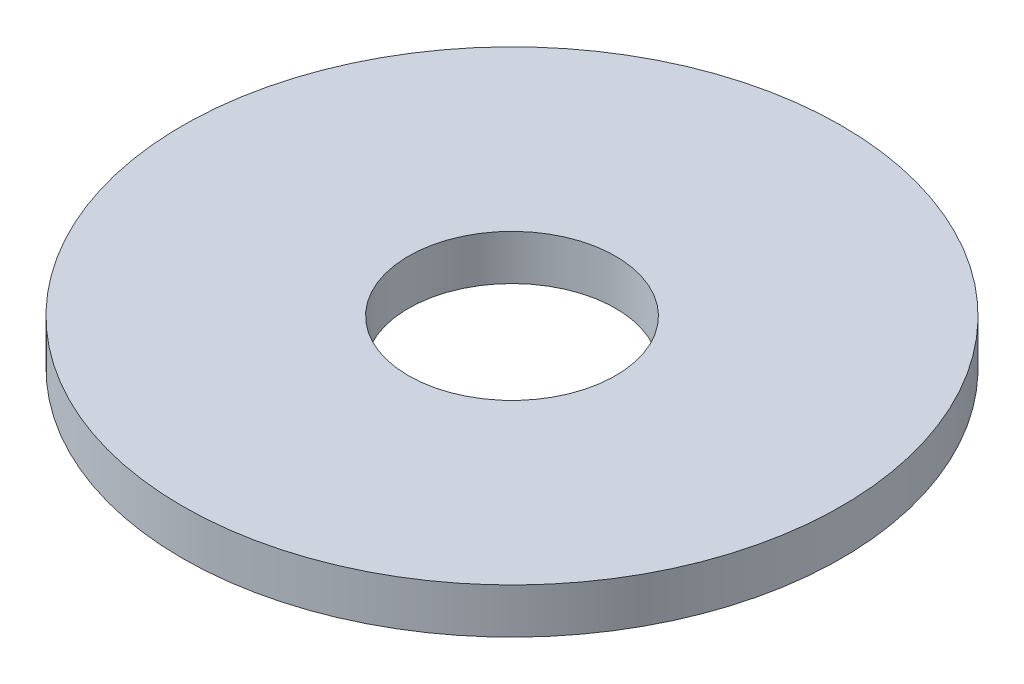
from build123d import *

# Parameters (mm, degrees)
SKETCH1_R           = 87.5
BOSS_EXTRUDE1_DEPTH = 12
SKETCH2_R           = 27.5
CUT_EXTRUDE1_DEPTH  = 125.324173032


with BuildPart() as part:
    # Sketch1 → Boss-Extrude1 (new body)
    with BuildSketch(Plane(origin=(0, 0, 0), x_dir=(1, 0, 0), z_dir=(0, 1, 0))):
        Circle(SKETCH1_R)
    extrude(amount=BOSS_EXTRUDE1_DEPTH)

    # Sketch2 → Cut-Extrude1 (cut, through all)
    with BuildSketch(Plane(origin=(0, 0, 0), x_dir=(1, 0, 0), z_dir=(0, 1, 0))):
        Circle(SKETCH2_R)
    extrude(amount=CUT_EXTRUDE1_DEPTH, mode=Mode.SUBTRACT)


solid = part.part
